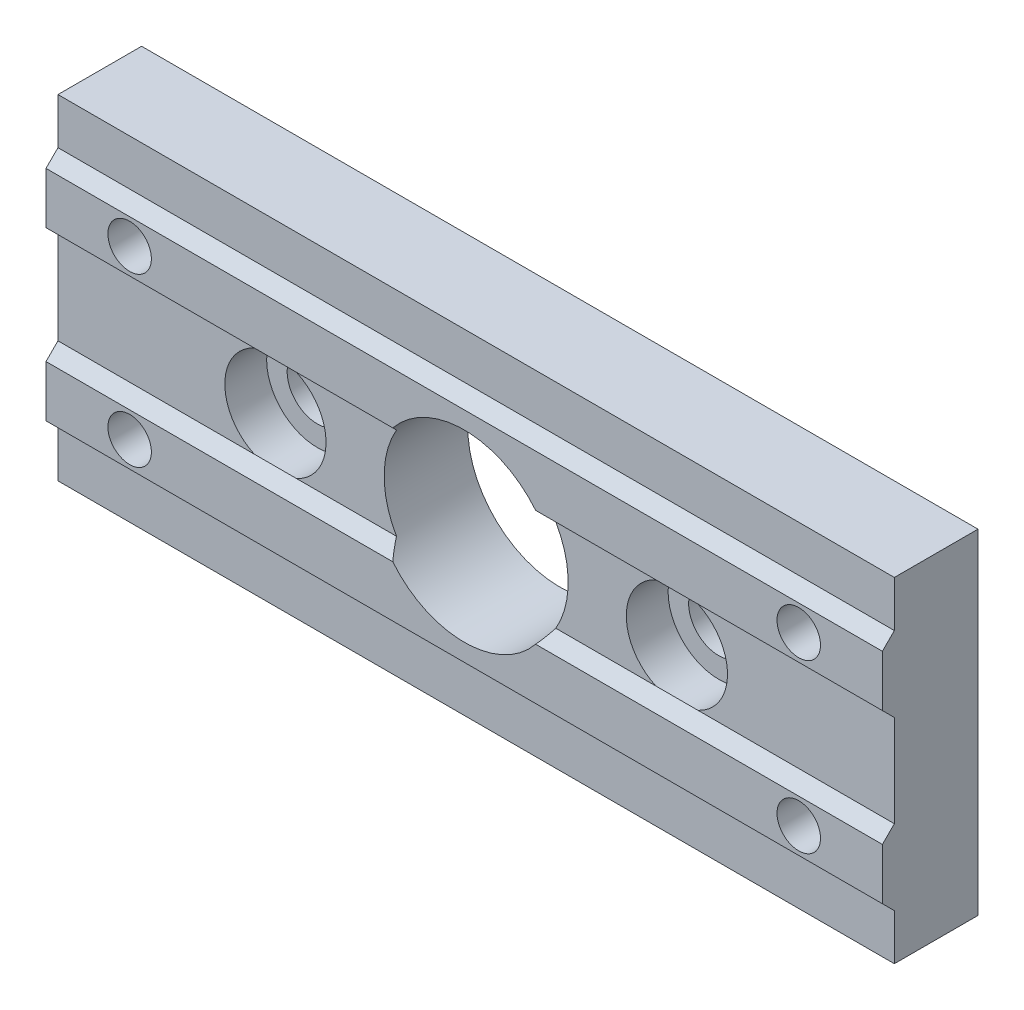
from build123d import *
from build123d.topology import SkipClean

# Parameters (mm, degrees)
SKETCH1_W               = 100
SKETCH1_H               = 40
SKETCH1_R               = 11
SKETCH1_R_2             = 2.6
SKETCH1_R_3             = 3.6
BOSS_EXTRUDE1_DEPTH     = 10
CUT_EXTRUDE1_START      = 10
SKETCH2_R               = 6.05
CUT_EXTRUDE1_DEPTH      = 5
SKETCH3_R               = 4.5
CUT_EXTRUDE2_DEPTH      = 5
BOSS_EXTRUDE3_START     = -50
SKETCH4_W               = 1.43
SKETCH4_H               = 9
BOSS_EXTRUDE3_DEPTH     = 100
CHAMFER1_SIZE           = 1.43
CUT_EXTRUDE4_DEPTH      = 56.051293354
CUT_EXTRUDE4_DEPTH_BACK = 56.051293354
SKETCH5_R               = 11
SKETCH5_R_2             = 2.6


with BuildPart() as part:
    # Sketch1 → Boss-Extrude1 (new body)
    with BuildSketch(Plane.XY):
        Rectangle(SKETCH1_W, SKETCH1_H)
        Circle(SKETCH1_R, mode=Mode.SUBTRACT)
        with Locations((-40, 10)):
            Circle(SKETCH1_R_2, mode=Mode.SUBTRACT)
        with Locations((-40, -10)):
            Circle(SKETCH1_R_2, mode=Mode.SUBTRACT)
        with Locations((40, 10)):
            Circle(SKETCH1_R_2, mode=Mode.SUBTRACT)
        with Locations((40, -10)):
            Circle(SKETCH1_R_2, mode=Mode.SUBTRACT)
        with Locations((-24, 0)):
            Circle(SKETCH1_R_3, mode=Mode.SUBTRACT)
        with Locations((24, 0)):
            Circle(SKETCH1_R_3, mode=Mode.SUBTRACT)
    extrude(amount=BOSS_EXTRUDE1_DEPTH)

    # Sketch2 → Cut-Extrude1 (cut)
    with BuildSketch(Plane.XY.offset(CUT_EXTRUDE1_START)):
        with Locations(Location((24, 0, 0), (0, 0, 180))):
            Circle(SKETCH2_R)
        with Locations(Location((-24, 0, 0), (0, 0, 180))):
            Circle(SKETCH2_R)
    extrude(amount=-CUT_EXTRUDE1_DEPTH, mode=Mode.SUBTRACT)

    # Sketch3 → Cut-Extrude2 (cut)
    with BuildSketch(Plane.XY):
        with Locations((40, 10)):
            Circle(SKETCH3_R)
        with Locations((40, -10)):
            Circle(SKETCH3_R)
        with Locations((-40, 10)):
            Circle(SKETCH3_R)
        with Locations((-40, -10)):
            Circle(SKETCH3_R)
    extrude(amount=CUT_EXTRUDE2_DEPTH, mode=Mode.SUBTRACT)

    # Sketch4 → Boss-Extrude3 (add)
    with BuildSketch(Plane(origin=(0, 0, 0), x_dir=(0, 0, -1), z_dir=(1, 0, 0)).offset(BOSS_EXTRUDE3_START)):
        with Locations((-10.715, 10)):
            Rectangle(SKETCH4_W, SKETCH4_H)
        with Locations((-10.715, -10)):
            Rectangle(SKETCH4_W, SKETCH4_H)
    extrude(amount=BOSS_EXTRUDE3_DEPTH)

    # Chamfer1
    chamfer1_edges = [part.edges().sort_by_distance(p)[0] for p in [
        (0, -14.5, 11.43),
        (0, -5.5, 11.43),
        (0, 5.5, 11.43),
        (0, 14.5, 11.43),
    ]]
    chamfer(chamfer1_edges, length=CHAMFER1_SIZE - 0.0001)  # a hair under: the kernel refuses the full size

    # Sketch5 → Cut-Extrude4 (cut, two sides: drawn at the far end of the back side and taken through both)
    with SkipClean():  # the faces are left unmerged after this step: merging them gives an invalid solid
        with BuildSketch(Plane.XY.offset(-CUT_EXTRUDE4_DEPTH_BACK)):
            with Locations(Location((0, 0, 0), (0, 0, 150))):
                Circle(SKETCH5_R)
            with Locations(Location((-40, 10, 0), (0, 0, 180))):
                Circle(SKETCH5_R_2)
            with Locations(Location((-40, -10, 0), (0, 0, 180))):
                Circle(SKETCH5_R_2)
            with Locations(Location((40, -10, 0), (0, 0, 180))):
                Circle(SKETCH5_R_2)
            with Locations(Location((40, 10, 0), (0, 0, 180))):
                Circle(SKETCH5_R_2)
        extrude(amount=CUT_EXTRUDE4_DEPTH + CUT_EXTRUDE4_DEPTH_BACK, mode=Mode.SUBTRACT)


solid = part.part
